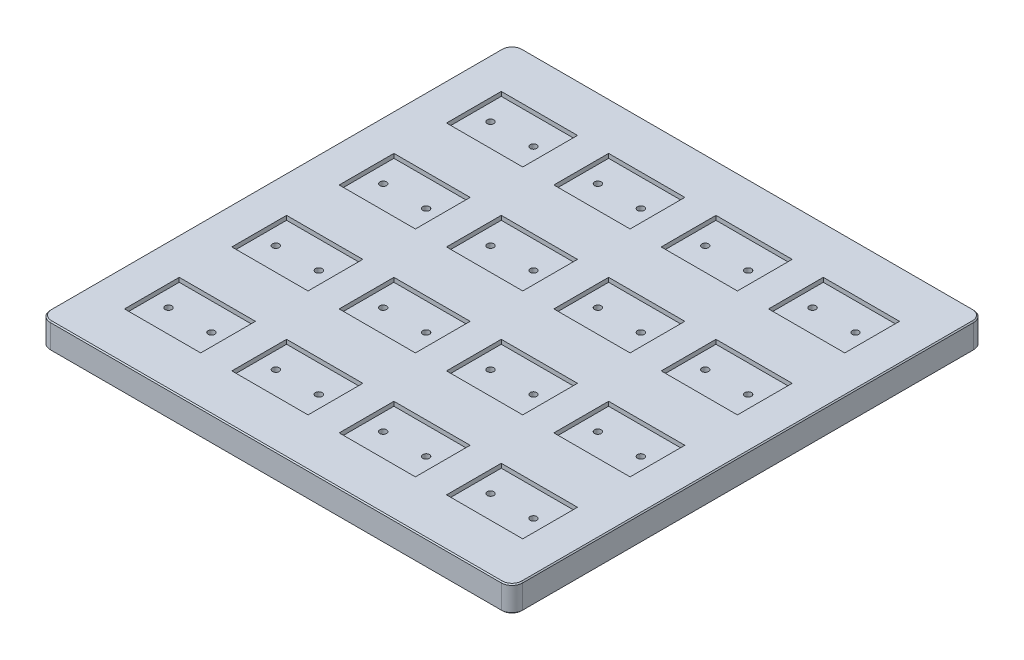
from build123d import *

# Parameters (mm, degrees)
SKETCH1_W            = 220
SKETCH1_H            = 220
BOSS_EXTRUDE1_DEPTH  = 12
SKETCH2_W            = 35.5
SKETCH2_H            = 25.5
CUT_EXTRUDE1_DEPTH   = 2
LPATTERN1_COUNT      = 4
LPATTERN1_PITCH      = 50
LPATTERN1_COUNT_DIR2 = 4
LPATTERN1_PITCH_DIR2 = 50
SKETCH3_R            = 1.55
CUT_EXTRUDE2_DEPTH   = 312.287648325
LPATTERN2_COUNT      = 4
LPATTERN2_PITCH      = 50
LPATTERN2_COUNT_DIR2 = 4
LPATTERN2_PITCH_DIR2 = 50
SKETCH4_W            = 200
SKETCH4_H            = 200
CUT_EXTRUDE3_DEPTH   = 3
FILLET1_R            = 5
CHAMFER1_SIZE        = 0.5


with BuildPart() as part:
    # Sketch1 → Boss-Extrude1 (new body)
    with BuildSketch(Plane(origin=(0, 0, 0), x_dir=(1, 0, 0), z_dir=(0, 1, 0))):
        with Locations((110, 110)):
            Rectangle(SKETCH1_W, SKETCH1_H)
    extrude(amount=BOSS_EXTRUDE1_DEPTH)

    # Sketch2 → Cut-Extrude1 (cut)
    with BuildSketch(Plane(origin=(0, 12, 0), x_dir=(1, 0, 0), z_dir=(0, 1, 0))):
        with Locations((35, 35)):
            Rectangle(SKETCH2_W, SKETCH2_H)
    cut_extrude1 = extrude(amount=-CUT_EXTRUDE1_DEPTH, mode=Mode.SUBTRACT)

    # LPattern1: Cut-Extrude1 4 × 4
    with Locations(*[(j * LPATTERN1_PITCH_DIR2, 0, -i * LPATTERN1_PITCH) for i in range(LPATTERN1_COUNT) for j in range(LPATTERN1_COUNT_DIR2) if (i, j) != (0, 0)]):
        add(cut_extrude1, mode=Mode.SUBTRACT)

    # Sketch3 → Cut-Extrude2 (cut, through all)
    with BuildSketch(Plane(origin=(0, 10, 0), x_dir=(1, 0, 0), z_dir=(0, 1, 0))):
        with Locations((25, 35)):
            Circle(SKETCH3_R)
        with Locations((45, 35)):
            Circle(SKETCH3_R)
    cut_extrude2 = extrude(amount=-CUT_EXTRUDE2_DEPTH, mode=Mode.SUBTRACT)

    # LPattern2: Cut-Extrude2 4 × 4
    with Locations(*[(j * LPATTERN2_PITCH_DIR2, 0, -i * LPATTERN2_PITCH) for i in range(LPATTERN2_COUNT) for j in range(LPATTERN2_COUNT_DIR2) if (i, j) != (0, 0)]):
        add(cut_extrude2, mode=Mode.SUBTRACT)

    # Sketch4 → Cut-Extrude3 (cut)
    with BuildSketch(Plane.XZ):
        with Locations((110, -110)):
            Rectangle(SKETCH4_W, SKETCH4_H)
    extrude(amount=-CUT_EXTRUDE3_DEPTH, mode=Mode.SUBTRACT)

    # Fillet1
    fillet1_edges = [part.edges().sort_by_distance(p)[0] for p in [
        (0, 6, -220),
        (0, 6, 0),
        (220, 6, 0),
        (220, 6, -220),
    ]]
    fillet(fillet1_edges, radius=FILLET1_R)

    # Chamfer1
    chamfer1_edges = [part.edges().sort_by_distance(p)[0] for p in [
        (0, 0, -110),
        (1.464466094, 0, -1.464466094),
        (1.464466094, 0, -218.535533906),
        (110, 0, 0),
        (110, 0, -220),
        (218.535533906, 0, -1.464466094),
        (218.535533906, 0, -218.535533906),
        (220, 0, -110),
        (0, 12, -110),
        (1.464466094, 12, -1.464466094),
        (1.464466094, 12, -218.535533906),
        (110, 12, 0),
        (110, 12, -220),
        (218.535533906, 12, -1.464466094),
        (218.535533906, 12, -218.535533906),
        (220, 12, -110),
    ]]
    chamfer(chamfer1_edges, length=CHAMFER1_SIZE)


solid = part.part
